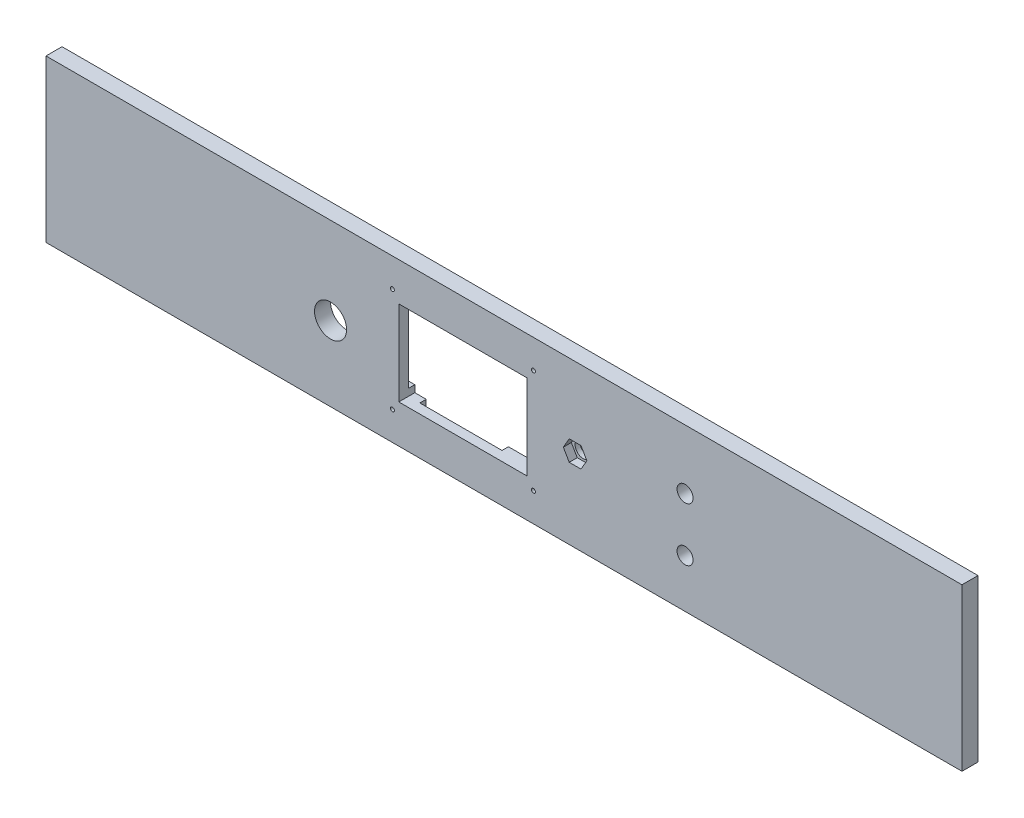
from build123d import *

# Parameters (mm, degrees)
SKETCH1_W                   = 571.5
SKETCH1_H                   = 100.8
BOSS_EXTRUDE1_DEPTH         = 5
SKETCH2_W                   = 80
SKETCH2_H                   = 53
CUT_EXTRUDE1_DEPTH          = 581.407520627
CUT_EXTRUDE2_DEPTH          = 4
SKETCH4_R                   = 7.5
CUT_EXTRUDE3_DEPTH          = 2
SKETCH5_R                   = 5
CUT_EXTRUDE4_DEPTH          = 581.376507106
CUT_EXTRUDE5_DEPTH          = 5
TAP_DRILL_FOR_M3X0_5_TAP1_D = 2.5
SKETCH9_R                   = 10
SKETCH9_R_2                 = 5
POWER_AND_USB_CABLES_DEPTH  = 581.407520627


with BuildPart() as part:
    # Sketch1 → Boss-Extrude1 (new, symmetric)
    with BuildSketch(Plane.XY):
        with Locations((285.75, 50.4)):
            Rectangle(SKETCH1_W, SKETCH1_H)
    extrude(amount=BOSS_EXTRUDE1_DEPTH, both=True)

    # Sketch2 → Cut-Extrude1 (cut, through all)
    with BuildSketch(Plane(origin=(0, 0, -5), x_dir=(-1, 0, 0), z_dir=(0, 0, -1))):
        with Locations((-260.123617772, 50.4)):
            Rectangle(SKETCH2_W, SKETCH2_H)
    extrude(amount=-CUT_EXTRUDE1_DEPTH, mode=Mode.SUBTRACT)

    # Sketch3 → Cut-Extrude2 (cut)
    with BuildSketch(Plane(origin=(0, 0, -5), x_dir=(-1, 0, 0), z_dir=(0, 0, -1))):
        Polygon((-300.123617772, 23.9), (-278.523617772, 23.9), (-278.523617772, 15.4), (-227.223617772, 15.4), (-227.223617772, 23.9), (-220.123617772, 23.9), (-220.123617772, 28.229247098), (-213.623617772, 28.229247098), (-213.623617772, 72.570752902), (-220.123617772, 72.570752902), (-220.123617772, 76.9), (-300.123617772, 76.9), align=None)
    extrude(amount=-CUT_EXTRUDE2_DEPTH, mode=Mode.SUBTRACT)

    # Sketch4 → Cut-Extrude3 (cut)
    with BuildSketch(Plane(origin=(0, 0, -5), x_dir=(-1, 0, 0), z_dir=(0, 0, -1))):
        with Locations((-330.123617772, 50.8)):
            Circle(SKETCH4_R)
    extrude(amount=-CUT_EXTRUDE3_DEPTH, mode=Mode.SUBTRACT)

    # Sketch5 → Cut-Extrude4 (cut, through all)
    with BuildSketch(Plane(origin=(0, 0, -3), x_dir=(-1, 0, 0), z_dir=(0, 0, -1))):
        with Locations((-330.123617772, 50.8)):
            Circle(SKETCH5_R)
    extrude(amount=-CUT_EXTRUDE4_DEPTH, mode=Mode.SUBTRACT)

    # Sketch6 → Cut-Extrude5 (cut)
    with BuildSketch(Plane.XY.offset(5)):
        Polygon((337.467513196, 50.8), (333.795565484, 57.16), (326.45167006, 57.16), (322.779722348, 50.8), (326.45167006, 44.44), (333.795565484, 44.44), align=None)
    extrude(amount=-CUT_EXTRUDE5_DEPTH, mode=Mode.SUBTRACT)

    # Tap Drill for M3x0.5 Tap1 (through all)
    with Locations(Plane(origin=(0, 0, -5), x_dir=(-1, 0, 0), z_dir=(0, 0, -1))):
        with Locations((-304.123617772, 82.9), (-304.123617772, 17.9), (-216.123617772, 17.9), (-216.123617772, 82.9)):
            Hole(TAP_DRILL_FOR_M3X0_5_TAP1_D / 2)

    # Sketch9 → power and usb cables (cut, through all)
    with BuildSketch(Plane.XY.offset(5)):
        with Locations((177.536724471, 46.600039321)):
            Circle(SKETCH9_R)
        with Locations((398.740788678, 63.702792605)):
            Circle(SKETCH9_R_2)
        with Locations((398.740788678, 30.252024765)):
            Circle(SKETCH9_R_2)
    extrude(amount=-POWER_AND_USB_CABLES_DEPTH, mode=Mode.SUBTRACT)


solid = part.part
